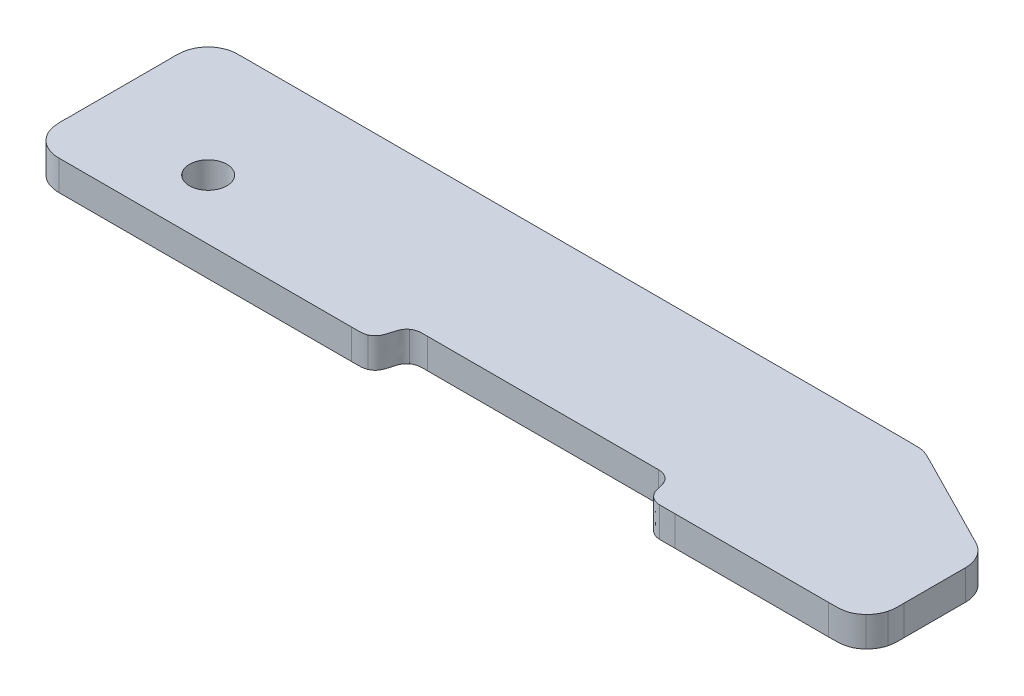
from build123d import *

# Parameters (mm, degrees)
SKETCH4_R           = 3.96875
BOSS_EXTRUDE1_DEPTH = 6.35


with BuildPart() as part:
    # Sketch4 → Boss-Extrude1 (new body)
    with BuildSketch(Plane(origin=(0, 0, 0), x_dir=(1, 0, 0), z_dir=(0, 1, 0))):
        with BuildLine():
            add(Edge.make_bspline(
                [(157.3945036, 35.575748), (161.28746, 33.591373), (165.173533, 31.6138814), (169.0664894, 29.6295064)],
                knots=[0, 0, 0, 0, 1, 1, 1, 1], degree=3))
            add(Edge.make_bspline(
                [(169.0664894, 29.6295064), (170.038014, 29.1333936), (171.0095386, 28.6373062), (171.9810378, 28.1412188)],
                knots=[0, 0, 0, 0, 1, 1, 1, 1], degree=3))
            add(Edge.make_bspline(
                [(171.9810378, 28.1412188), (172.9525624, 27.6520148), (173.9378538, 27.1972786), (174.8818194, 26.6529312)],
                knots=[0, 0, 0, 0, 1, 1, 1, 1], degree=3))
            add(Edge.make_bspline(
                [(174.8818194, 26.6529312), (176.845674168, 25.522871997), (178.058382888, 23.42110905), (178.058190977, 21.154029732)],
                knots=[0, 0, 0, 0, 1.00007912, 1.00007912, 1.00007912, 1.00007912], degree=3))
            add(Edge.make_bspline(
                [(178.058190977, 21.154029732), (178.057823515, 16.813399333), (178.05745549, 12.46586099), (178.057087466, 8.118322647)],
                knots=[4.1319e-05, 4.1319e-05, 4.1319e-05, 4.1319e-05, 1, 1, 1, 1], degree=3))
            add(Edge.make_bspline(
                [(178.057087466, 8.118322647), (178.057457698, 7.050328911), (178.126784145, 5.99615128), (177.8376936, 4.934966)],
                knots=[0, 0, 0, 0, 1, 1, 1, 1], degree=3))
            add(Edge.make_bspline(
                [(177.8376936, 4.934966), (177.5207524, 3.7567616), (176.9764304, 2.8472638), (176.101375, 1.9997674)],
                knots=[0, 0, 0, 0, 1, 1, 1, 1], degree=3))
            add(Edge.make_bspline(
                [(176.101375, 1.9997674), (174.117, 0.1049528), (172.3462136, 0.2358644), (169.9208692, 0.2358644)],
                knots=[0, 0, 0, 0, 1, 1, 1, 1], degree=3))
            add(Edge.make_bspline(
                [(169.9208692, 0.2358644), (161.232342, 0.2358644), (152.5369314, 0.2358644), (143.8483788, 0.2358644)],
                knots=[0, 0, 0, 0, 1, 1, 1, 1], degree=3))
            add(Edge.make_bspline(
                [(143.8483788, 0.2358644), (141.664182, 0.2358644), (139.486894, 0.2358644), (137.309606, 0.2358644)],
                knots=[0, 0, 0, 0, 1, 1, 1, 1], degree=3))
            add(Edge.make_bspline(
                [(137.309606, 0.2358644), (136.2209366, 0.2358644), (135.139176, 0.2013712), (134.050532, 0.2358644)],
                knots=[0, 0, 0, 0, 1, 1, 1, 1], degree=3))
            add(Edge.make_bspline(
                [(134.050532, 0.2358644), (132.8998866, 0.2703576), (131.8594518, 0.9180068), (131.3288966, 1.9377406)],
                knots=[0, 0, 0, 0, 1, 1, 1, 1], degree=3))
            add(Edge.make_bspline(
                [(131.3288966, 1.9377406), (130.8190424, 2.9161486), (130.8810692, 4.0323516), (130.3160462, 5.0038762)],
                knots=[0, 0, 0, 0, 1, 1, 1, 1], degree=3))
            add(Edge.make_bspline(
                [(130.3160462, 5.0038762), (129.7372818, 6.0029598), (128.6830802, 6.5817496), (127.5324094, 6.5817496)],
                knots=[0, 0, 0, 0, 1, 1, 1, 1], degree=3))
            add(Edge.make_bspline(
                [(127.5324094, 6.5817496), (125.3551214, 6.5817496), (123.177808, 6.5817496), (121.00052, 6.5817496)],
                knots=[0, 0, 0, 0, 1, 1, 1, 1], degree=3))
            add(Edge.make_bspline(
                [(121.00052, 6.5817496), (112.2844084, 6.5817496), (103.575231, 6.5817496), (94.8591194, 6.5817496)],
                knots=[0, 0, 0, 0, 1, 1, 1, 1], degree=3))
            add(Edge.make_bspline(
                [(94.8591194, 6.5817496), (90.504518, 6.5817496), (86.1430332, 6.5817496), (81.7815484, 6.5817496)],
                knots=[0, 0, 0, 0, 1, 1, 1, 1], degree=3))
            add(Edge.make_bspline(
                [(81.7815484, 6.5817496), (80.6929044, 6.5817496), (79.604235, 6.5817496), (78.515591, 6.5817496)],
                knots=[0, 0, 0, 0, 1, 1, 1, 1], degree=3))
            add(Edge.make_bspline(
                [(78.515591, 6.5817496), (77.399388, 6.5817496), (76.3727454, 6.7194938), (75.3461028, 5.9685174)],
                knots=[0, 0, 0, 0, 1, 1, 1, 1], degree=3))
            add(Edge.make_bspline(
                [(75.3461028, 5.9685174), (73.37552, 4.5284644), (74.5055152, 1.6759174), (71.963026, 0.5183632)],
                knots=[0, 0, 0, 0, 1, 1, 1, 1], degree=3))
            add(Edge.make_bspline(
                [(71.963026, 0.5183632), (71.122413, 0.1325118), (69.572124, 0.2358644), (68.7315364, 0.2358644)],
                knots=[0, 0, 0, 0, 1, 1, 1, 1], degree=3))
            add(Edge.make_bspline(
                [(68.7315364, 0.2358644), (67.642867, 0.2358644), (66.554223, 0.2358644), (65.465579, 0.2358644)],
                knots=[0, 0, 0, 0, 1, 1, 1, 1], degree=3))
            add(Edge.make_bspline(
                [(65.465579, 0.2358644), (63.2882656, 0.2358644), (61.1040942, 0.2358644), (58.9267808, 0.2358644)],
                knots=[0, 0, 0, 0, 1, 1, 1, 1], degree=3))
            add(Edge.make_bspline(
                [(58.9267808, 0.2358644), (54.565296, 0.2358644), (50.2106946, 0.2358644), (45.8492098, 0.2358644)],
                knots=[0, 0, 0, 0, 1, 1, 1, 1], degree=3))
            add(Edge.make_bspline(
                [(45.8492098, 0.2358644), (37.1537738, 0.2358644), (28.4514798, 0.2358644), (19.7491604, 0.2358644)],
                knots=[0, 0, 0, 0, 1, 1, 1, 1], degree=3))
            add(Edge.make_bspline(
                [(19.7491604, 0.2358644), (15.4014424, 0.2358644), (11.046841, 0.2358644), (6.699123, 0.2358644)],
                knots=[0, 0, 0, 0, 1, 1, 1, 1], degree=3))
            add(Edge.make_bspline(
                [(6.699123, 0.2358644), (4.3633644, 0.2358644), (2.2618446, 1.3865352), (1.0905236, 3.4329116)],
                knots=[0, 0, 0, 0, 1, 1, 1, 1], degree=3))
            add(Edge.make_bspline(
                [(1.0905236, 3.4329116), (-0.0325882, 5.4035198), (0.256794, 7.8081886), (0.256794, 9.8201226)],
                knots=[0, 0, 0, 0, 1, 1, 1, 1], degree=3))
            add(Edge.make_bspline(
                [(0.256794, 9.8201226), (0.256794, 14.1678406), (0.256794, 18.5155586), (0.256794, 22.8563678)],
                knots=[0, 0, 0, 0, 1, 1, 1, 1], degree=3))
            add(Edge.make_bspline(
                [(0.256794, 22.8563678), (0.256794, 25.0336558), (0.256794, 27.2040858), (0.256794, 29.3744904)],
                knots=[0, 0, 0, 0, 1, 1, 1, 1], degree=3))
            add(Edge.make_bspline(
                [(0.256794, 29.3744904), (0.256794, 31.600013), (-0.0118872, 33.6464148), (1.4832584, 35.6859078)],
                knots=[0, 0, 0, 0, 1, 1, 1, 1], degree=3))
            add(Edge.make_bspline(
                [(1.4832584, 35.6859078), (2.21361, 36.6849914), (3.0611064, 37.3464328), (4.197985, 37.8149866)],
                knots=[0, 0, 0, 0, 1, 1, 1, 1], degree=3))
            add(Edge.make_bspline(
                [(4.197985, 37.8149866), (5.2453032, 38.2421892), (6.2788292, 38.2834896), (7.3674732, 38.2834896)],
                knots=[0, 0, 0, 0, 1, 1, 1, 1], degree=3))
            add(Edge.make_bspline(
                [(7.3674732, 38.2834896), (9.5379032, 38.2834896), (11.7083078, 38.2834896), (13.8855958, 38.2834896)],
                knots=[0, 0, 0, 0, 1, 1, 1, 1], degree=3))
            add(Edge.make_bspline(
                [(13.8855958, 38.2834896), (18.2264304, 38.2834896), (22.574123, 38.2834896), (26.921841, 38.2834896)],
                knots=[0, 0, 0, 0, 1, 1, 1, 1], degree=3))
            add(Edge.make_bspline(
                [(26.921841, 38.2834896), (44.4091568, 38.2834896), (61.8964472, 38.2834896), (79.3906464, 38.2834896)],
                knots=[0, 0, 0, 0, 1, 1, 1, 1], degree=3))
            add(Edge.make_bspline(
                [(79.3906464, 38.2834896), (96.8572866, 38.2834896), (114.3308102, 38.2834896), (131.7974504, 38.2834896)],
                knots=[0, 0, 0, 0, 1, 1, 1, 1], degree=3))
            add(Edge.make_bspline(
                [(131.7974504, 38.2834896), (136.1589352, 38.2834896), (140.5273034, 38.2834896), (144.8888136, 38.2834896)],
                knots=[0, 0, 0, 0, 1, 1, 1, 1], degree=3))
            add(Edge.make_bspline(
                [(144.8888136, 38.2834896), (145.4744614, 38.2834896), (150.8419386, 38.3039874), (151.4344952, 38.2215898)],
                knots=[0, 0, 0, 0, 1, 1, 1, 1], degree=3))
            add(Edge.make_bspline(
                [(151.4344952, 38.2215898), (152.5644904, 38.0630176), (153.5015472, 37.560123), (154.4799552, 37.0571268)],
                knots=[0, 0, 0, 0, 1, 1, 1, 1], degree=3))
            add(Edge.make_bspline(
                [(154.4799552, 37.0571268), (155.4514798, 36.5679228), (156.422979, 36.0718354), (157.3945036, 35.575748)],
                knots=[0, 0, 0, 0, 1, 1, 1, 1], degree=3))
        make_face()
        with Locations((25.6540508, 12.9344928)):
            Circle(SKETCH4_R, mode=Mode.SUBTRACT)
    extrude(amount=BOSS_EXTRUDE1_DEPTH)


solid = part.part
